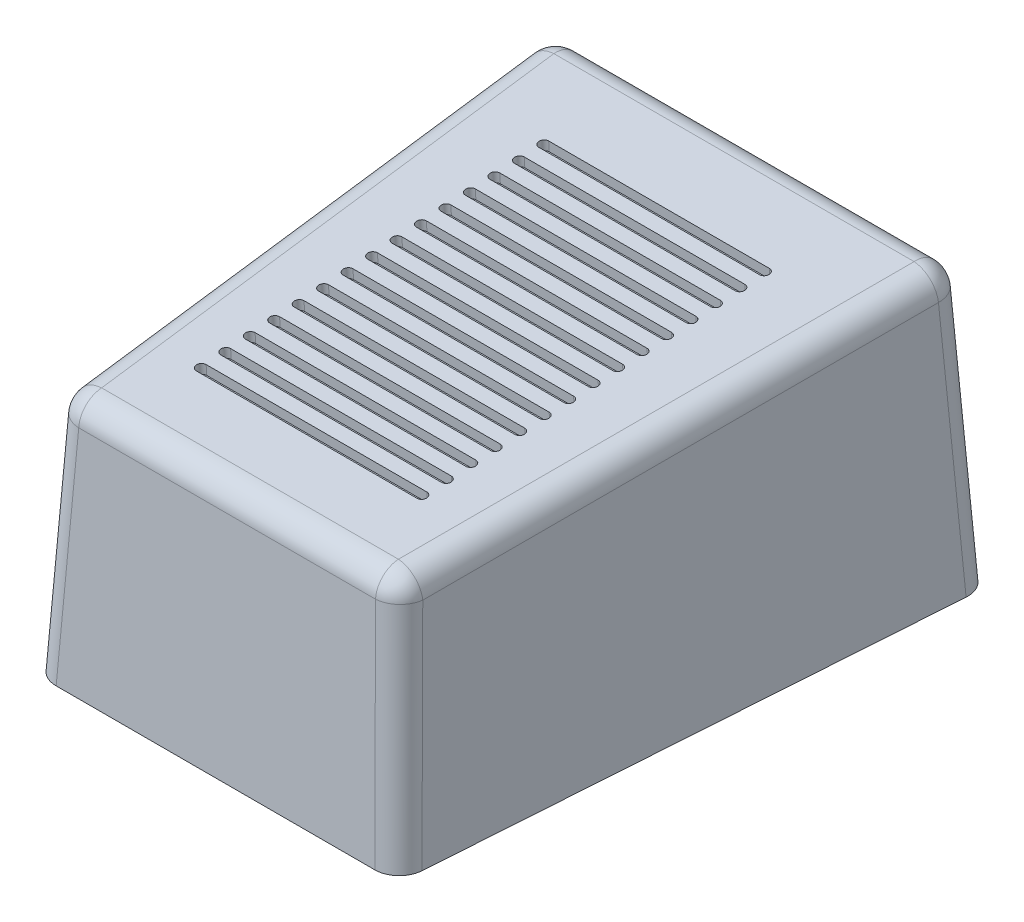
from build123d import *

# Parameters (mm, degrees)
BOSS_EXTRUDE1_DEPTH = 57
BOSS_EXTRUDE1_TAPER = 3
CUT_EXTRUDE5_DEPTH  = 153.05077859
FILLET1_R           = 5
CUT_EXTRUDE6_DEPTH  = 2


with BuildPart() as part:
    # Sketch1 → Boss-Extrude1 (new body)
    with BuildSketch(Plane(origin=(0, 0, 0), x_dir=(1, 0, 0), z_dir=(0, 1, 0))):
        Polygon((0, 0), (74.3, 0), (82.15, 113.789940148), (-7.85, 113.789940148), align=None)
    extrude(amount=BOSS_EXTRUDE1_DEPTH, taper=BOSS_EXTRUDE1_TAPER)

    # Sketch3 → Cut-Extrude5 (cut, through all, along a direction that is not the sketch's normal)
    with BuildSketch(Plane(origin=(0, 0, 0), x_dir=(0.06863423219194356, -0.0036055168297469387, 0.9976353754853589), z_dir=(-0.9962616574494623, 0.05233595624294397, 0.0687288700633672))):
        Polygon((-111.065324518, 56.677595682), (-2.994323871, 57.067784774), (-2.623000223, 49.990855578), align=None)
    extrude(amount=-CUT_EXTRUDE5_DEPTH, dir=(-1, 0, 0), mode=Mode.SUBTRACT)

    # Fillet1
    fillet1_edges = [part.edges().sort_by_distance(p)[0] for p in [
        (37.15, 49.931476738, -2.616797812),
        (-1.103541725, 53.465738369, -56.709747271),
        (37.15, 57, -110.802696729),
        (75.403541725, 53.465738369, -56.709747271),
        (80.549788175, 28.5, -112.296318439),
        (-6.249788175, 28.5, -112.296318439),
        (73.07875355, 24.965738369, -1.308398906),
        (1.22124645, 24.965738369, -1.308398906),
    ]]
    fillet(fillet1_edges, radius=FILLET1_R)

    # Sketch4 → Cut-Extrude6 (cut)
    with BuildSketch(Plane(origin=(0, 49.548983776, 3.237373336), x_dir=(1, 0, 0), z_dir=(0, 0.997872359176265, 0.06519781278536248))):
        with BuildLine():
            Line((14.329245801, 94.210038911), (59.329245801, 94.210038911))
            ThreePointArc((59.329245801, 94.210038911), (60.329245801, 93.210038911), (59.329245801, 92.210038911))
            Line((59.329245801, 92.210038911), (14.329245801, 92.210038911))
            ThreePointArc((14.329245801, 92.210038911), (13.329245801, 93.210038911), (14.329245801, 94.210038911))
        make_face()
        with BuildLine():
            Line((14.329245801, 89.210038911), (59.329245801, 89.210038911))
            ThreePointArc((59.329245801, 89.210038911), (60.329245801, 88.210038911), (59.329245801, 87.210038911))
            Line((59.329245801, 87.210038911), (14.329245801, 87.210038911))
            ThreePointArc((14.329245801, 87.210038911), (13.329245801, 88.210038911), (14.329245801, 89.210038911))
        make_face()
        with BuildLine():
            Line((14.329245801, 84.210038911), (59.329245801, 84.210038911))
            ThreePointArc((59.329245801, 84.210038911), (60.329245801, 83.210038911), (59.329245801, 82.210038911))
            Line((59.329245801, 82.210038911), (14.329245801, 82.210038911))
            ThreePointArc((14.329245801, 82.210038911), (13.329245801, 83.210038911), (14.329245801, 84.210038911))
        make_face()
        with BuildLine():
            Line((14.329245801, 79.210038911), (59.329245801, 79.210038911))
            ThreePointArc((59.329245801, 79.210038911), (60.329245801, 78.210038911), (59.329245801, 77.210038911))
            Line((59.329245801, 77.210038911), (14.329245801, 77.210038911))
            ThreePointArc((14.329245801, 77.210038911), (13.329245801, 78.210038911), (14.329245801, 79.210038911))
        make_face()
        with BuildLine():
            Line((14.329245801, 74.210038911), (59.329245801, 74.210038911))
            ThreePointArc((59.329245801, 74.210038911), (60.329245801, 73.210038911), (59.329245801, 72.210038911))
            Line((59.329245801, 72.210038911), (14.329245801, 72.210038911))
            ThreePointArc((14.329245801, 72.210038911), (13.329245801, 73.210038911), (14.329245801, 74.210038911))
        make_face()
        with BuildLine():
            Line((14.329245801, 69.210038911), (59.329245801, 69.210038911))
            ThreePointArc((59.329245801, 69.210038911), (60.329245801, 68.210038911), (59.329245801, 67.210038911))
            Line((59.329245801, 67.210038911), (14.329245801, 67.210038911))
            ThreePointArc((14.329245801, 67.210038911), (13.329245801, 68.210038911), (14.329245801, 69.210038911))
        make_face()
        with BuildLine():
            Line((14.329245801, 64.210038911), (59.329245801, 64.210038911))
            ThreePointArc((59.329245801, 64.210038911), (60.329245801, 63.210038911), (59.329245801, 62.210038911))
            Line((59.329245801, 62.210038911), (14.329245801, 62.210038911))
            ThreePointArc((14.329245801, 62.210038911), (13.329245801, 63.210038911), (14.329245801, 64.210038911))
        make_face()
        with BuildLine():
            Line((14.329245801, 59.210038911), (59.329245801, 59.210038911))
            ThreePointArc((59.329245801, 59.210038911), (60.329245801, 58.210038911), (59.329245801, 57.210038911))
            Line((59.329245801, 57.210038911), (14.329245801, 57.210038911))
            ThreePointArc((14.329245801, 57.210038911), (13.329245801, 58.210038911), (14.329245801, 59.210038911))
        make_face()
        with BuildLine():
            Line((14.329245801, 54.210038911), (59.329245801, 54.210038911))
            ThreePointArc((59.329245801, 54.210038911), (60.329245801, 53.210038911), (59.329245801, 52.210038911))
            Line((59.329245801, 52.210038911), (14.329245801, 52.210038911))
            ThreePointArc((14.329245801, 52.210038911), (13.329245801, 53.210038911), (14.329245801, 54.210038911))
        make_face()
        with BuildLine():
            Line((14.329245801, 49.210038911), (59.329245801, 49.210038911))
            ThreePointArc((59.329245801, 49.210038911), (60.329245801, 48.210038911), (59.329245801, 47.210038911))
            Line((59.329245801, 47.210038911), (14.329245801, 47.210038911))
            ThreePointArc((14.329245801, 47.210038911), (13.329245801, 48.210038911), (14.329245801, 49.210038911))
        make_face()
        with BuildLine():
            Line((14.329245801, 44.210038911), (59.329245801, 44.210038911))
            ThreePointArc((59.329245801, 44.210038911), (60.329245801, 43.210038911), (59.329245801, 42.210038911))
            Line((59.329245801, 42.210038911), (14.329245801, 42.210038911))
            ThreePointArc((14.329245801, 42.210038911), (13.329245801, 43.210038911), (14.329245801, 44.210038911))
        make_face()
        with BuildLine():
            Line((14.329245801, 39.210038911), (59.329245801, 39.210038911))
            ThreePointArc((59.329245801, 39.210038911), (60.329245801, 38.210038911), (59.329245801, 37.210038911))
            Line((59.329245801, 37.210038911), (14.329245801, 37.210038911))
            ThreePointArc((14.329245801, 37.210038911), (13.329245801, 38.210038911), (14.329245801, 39.210038911))
        make_face()
        with BuildLine():
            Line((14.329245801, 34.210038911), (59.329245801, 34.210038911))
            ThreePointArc((59.329245801, 34.210038911), (60.329245801, 33.210038911), (59.329245801, 32.210038911))
            Line((59.329245801, 32.210038911), (14.329245801, 32.210038911))
            ThreePointArc((14.329245801, 32.210038911), (13.329245801, 33.210038911), (14.329245801, 34.210038911))
        make_face()
        with BuildLine():
            Line((14.329245801, 29.210038911), (59.329245801, 29.210038911))
            ThreePointArc((59.329245801, 29.210038911), (60.329245801, 28.210038911), (59.329245801, 27.210038911))
            Line((59.329245801, 27.210038911), (14.329245801, 27.210038911))
            ThreePointArc((14.329245801, 27.210038911), (13.329245801, 28.210038911), (14.329245801, 29.210038911))
        make_face()
        with BuildLine():
            Line((14.329245801, 24.210038911), (59.329245801, 24.210038911))
            ThreePointArc((59.329245801, 24.210038911), (60.329245801, 23.210038911), (59.329245801, 22.210038911))
            Line((59.329245801, 22.210038911), (14.329245801, 22.210038911))
            ThreePointArc((14.329245801, 22.210038911), (13.329245801, 23.210038911), (14.329245801, 24.210038911))
        make_face()
    extrude(amount=-CUT_EXTRUDE6_DEPTH, mode=Mode.SUBTRACT)


solid = part.part
